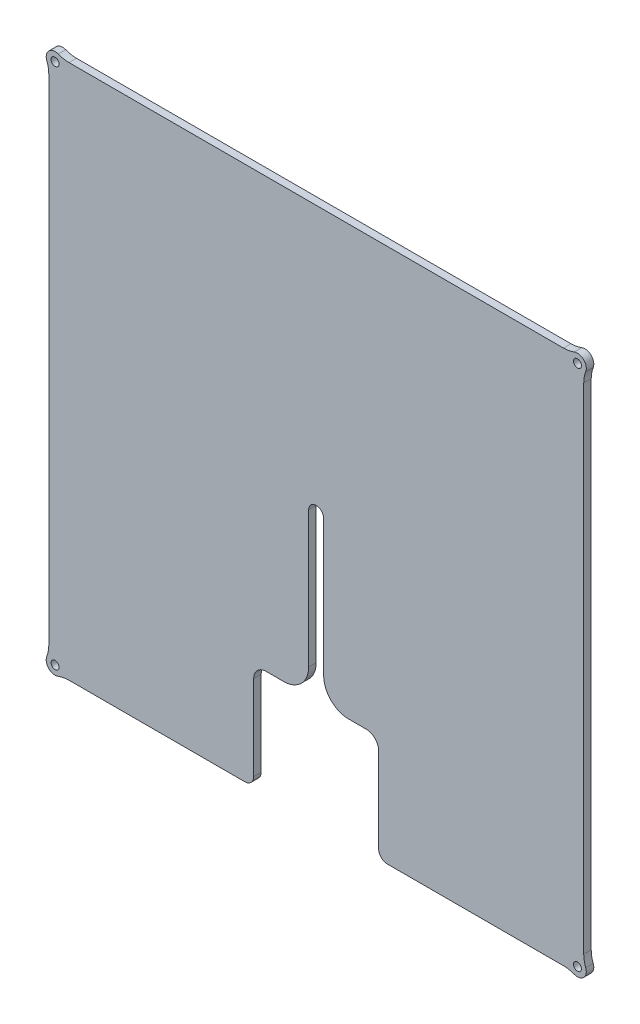
from build123d import *

# Parameters (mm, degrees)
SKETCH1_R           = 1.6
BOSS_EXTRUDE1_DEPTH = 3
CUT_EXTRUDE5_DEPTH  = 153.814767522
FILLET1_R           = 3.54


with BuildPart() as part:
    # Sketch1 → Boss-Extrude1 (new body)
    with BuildSketch(Plane.XY):
        with BuildLine():
            Line((-107, 98.923010333), (-107, -98.923010333))
            ThreePointArc((-107, -98.923010333), (-107.201661971, -101.11372249), (-107.799869959, -103.230804092))
            ThreePointArc((-107.799869959, -103.230804092), (-107, -107), (-103.230804092, -107.799869959))
            ThreePointArc((-103.230804092, -107.799869959), (-101.11372249, -107.201661971), (-98.923010333, -107))
            Line((-98.923010333, -107), (-43, -107))
            Line((-43, -107), (43, -107))
            Line((43, -107), (98.923010333, -107))
            ThreePointArc((98.923010333, -107), (101.11372249, -107.201661971), (103.230804092, -107.799869959))
            ThreePointArc((103.230804092, -107.799869959), (107, -107), (107.799869959, -103.230804092))
            ThreePointArc((107.799869959, -103.230804092), (107.201661971, -101.11372249), (107, -98.923010333))
            Line((107, -98.923010333), (107, 98.923010333))
            ThreePointArc((107, 98.923010333), (107.201661971, 101.11372249), (107.799869959, 103.230804092))
            ThreePointArc((107.799869959, 103.230804092), (107, 107), (103.230804092, 107.799869959))
            ThreePointArc((103.230804092, 107.799869959), (101.11372249, 107.201661971), (98.923010333, 107))
            Line((98.923010333, 107), (-98.923010333, 107))
            ThreePointArc((-98.923010333, 107), (-101.11372249, 107.201661971), (-103.230804092, 107.799869959))
            ThreePointArc((-103.230804092, 107.799869959), (-107, 107), (-107.799869959, 103.230804092))
            ThreePointArc((-107.799869959, 103.230804092), (-107.201661971, 101.11372249), (-107, 98.923010333))
        make_face()
        with Locations((-104.5, -104.5)):
            Circle(SKETCH1_R, mode=Mode.SUBTRACT)
        with Locations((-104.5, 104.5)):
            Circle(SKETCH1_R, mode=Mode.SUBTRACT)
        with Locations((104.5, 104.5)):
            Circle(SKETCH1_R, mode=Mode.SUBTRACT)
        with Locations((104.5, -104.5)):
            Circle(SKETCH1_R, mode=Mode.SUBTRACT)
    extrude(amount=BOSS_EXTRUDE1_DEPTH)

    # Sketch5 → Cut-Extrude5 (cut, through all)
    with BuildSketch(Plane.XY):
        with BuildLine():
            Line((-25.033358746, -107), (24.966641254, -107))
            Line((24.966641254, -107), (24.966641254, -69.5))
            ThreePointArc((24.966641254, -69.5), (23.50217516, -65.964466094), (19.966641254, -64.5))
            Line((19.966641254, -64.5), (12.966641254, -64.5))
            ThreePointArc((12.966641254, -64.5), (5.895573442, -61.571067812), (2.966641254, -54.5))
            Line((2.966641254, -54.5), (2.966641254, 0))
            ThreePointArc((2.966641254, 0), (-0.033358746, 3), (-3.033358746, 0))
            Line((-3.033358746, 0), (-3.033358746, -54.5))
            ThreePointArc((-3.033358746, -54.5), (-5.962290934, -61.571067812), (-13.033358746, -64.5))
            Line((-13.033358746, -64.5), (-20.033358746, -64.5))
            ThreePointArc((-20.033358746, -64.5), (-23.568892652, -65.964466094), (-25.033358746, -69.5))
            Line((-25.033358746, -69.5), (-25.033358746, -107))
        make_face()
    extrude(amount=CUT_EXTRUDE5_DEPTH, mode=Mode.SUBTRACT)

    # Fillet1
    fillet1_edges = [part.edges().sort_by_distance(p)[0] for p in [
        (-25.033358746, -107, 1.5),
        (24.966641254, -107, 1.5),
    ]]
    fillet(fillet1_edges, radius=FILLET1_R)


solid = part.part
